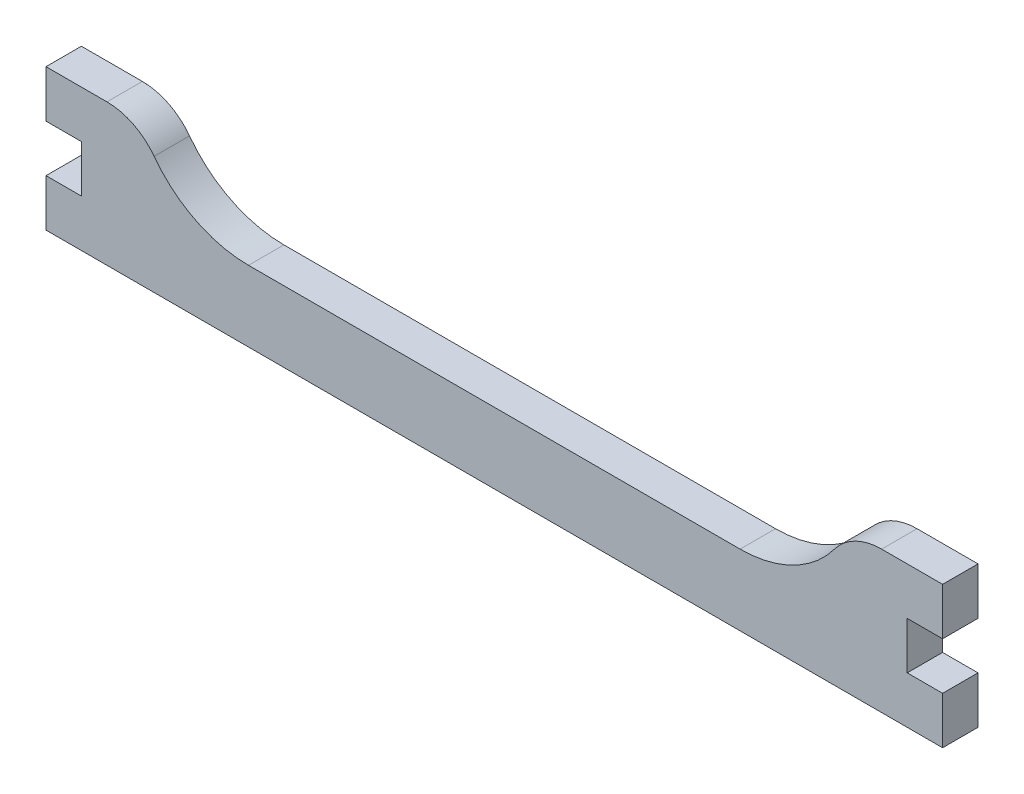
from build123d import *

# Parameters (mm, degrees)
SKETCH1_W           = 70
SKETCH1_H           = 12
BOSS_EXTRUDE1_DEPTH = 1.5
SKETCH2_W           = 60
SKETCH2_H           = 6
CUT_EXTRUDE1_DEPTH  = 38.121422387
FILLET1_R           = 10
FILLET2_R           = 5
SKETCH3_W           = 3
SKETCH3_H           = 4
BOSS_EXTRUDE2_DEPTH = 3


with BuildPart() as part:
    # Sketch1 → Boss-Extrude1 (new, symmetric)
    with BuildSketch(Plane.XY):
        with Locations((0, 6)):
            Rectangle(SKETCH1_W, SKETCH1_H)
    extrude(amount=BOSS_EXTRUDE1_DEPTH, both=True)

    # Sketch2 → Cut-Extrude1 (cut, through all)
    with BuildSketch(Plane.XY.offset(1.5)):
        with Locations((0, 9)):
            Rectangle(SKETCH2_W, SKETCH2_H)
    extrude(amount=-CUT_EXTRUDE1_DEPTH, mode=Mode.SUBTRACT)

    # Fillet1
    # the kernel refuses this fillet: 10 mm, written as the material it adds along each edge
    with BuildSketch(Plane(origin=(30, 6, 1.5), x_dir=(-1, 0, 0), z_dir=(0, 0, -1))) as fillet1_piece_1:
        with BuildLine():
            CenterArc((9.16515139, 10), FILLET1_R, 203.578178478, 66.421821522)
            Line((0, 6), (-0.183303028, 5.92))
            ThreePointArc((-0.183303028, 5.92), (-0.2, 3), (-0.2, 0))
            Line((-0.2, 0), (0, -0.2))
            Line((0, -0.2), (9.16515139, -0.2))
            Line((9.16515139, -0.2), (9.16515139, 0))
        make_face()
    extrude(amount=3)
    with BuildSketch(Plane(origin=(-30, 6, 1.5), x_dir=(0, 1, 0), z_dir=(0, 0, -1))) as fillet1_piece_2:
        with BuildLine():
            CenterArc((10, 9.16515139), FILLET1_R, 180, 66.421821522)
            Line((0, 9.16515139), (-0.2, 9.16515139))
            Line((-0.2, 9.16515139), (-0.2, 0))
            Line((-0.2, 0), (0, -0.2))
            ThreePointArc((0, -0.2), (3, -0.2), (5.92, -0.183303028))
            Line((5.92, -0.183303028), (6, 0))
        make_face()
    extrude(amount=3)

    # Fillet2
    fillet2_edges = [part.edges().sort_by_distance(p)[0] for p in [
        (-30, 12, 0),
        (30, 12, 0),
    ]]
    fillet(fillet2_edges, radius=FILLET2_R)

    # Sketch3 → Boss-Extrude2 (add)
    with BuildSketch(Plane.XY.offset(1.5)):
        with Locations((36.5, 10)):
            Rectangle(SKETCH3_W, SKETCH3_H)
        with Locations((36.5, 2)):
            Rectangle(SKETCH3_W, SKETCH3_H)
        with Locations((-36.5, 2)):
            Rectangle(SKETCH3_W, SKETCH3_H)
        with Locations((-36.5, 10)):
            Rectangle(SKETCH3_W, SKETCH3_H)
    extrude(amount=-BOSS_EXTRUDE2_DEPTH)


solid = part.part
